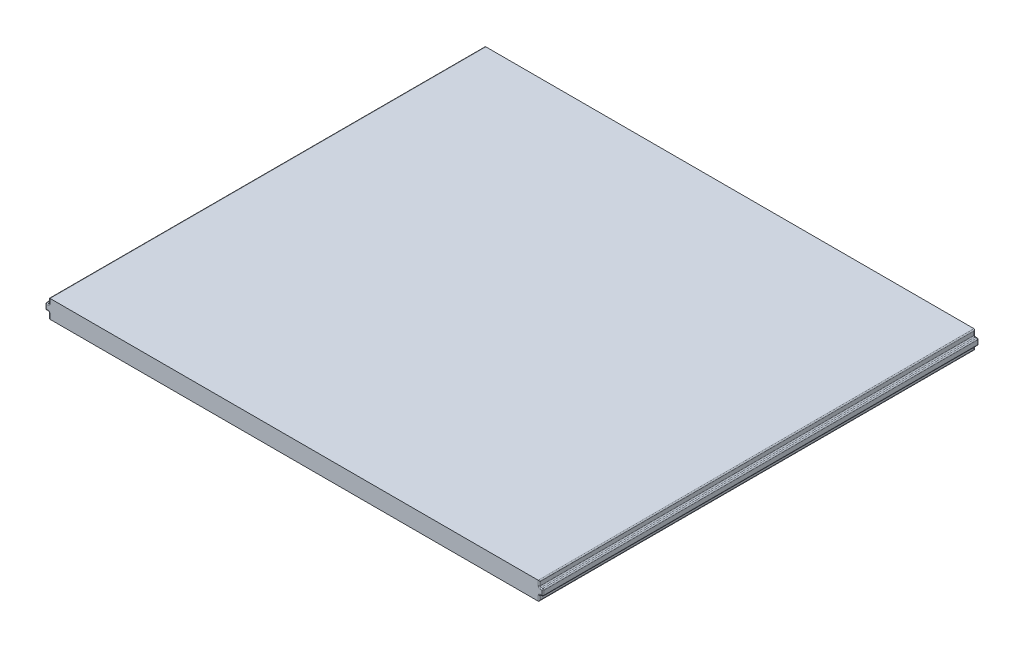
from build123d import *

# Parameters (mm, degrees)
SKETCH1_W           = 135
SKETCH1_H           = 120
BOSS_EXTRUDE1_DEPTH = 5
SKETCH2_W           = 120
SKETCH2_H           = 1.75
BOSS_EXTRUDE2_DEPTH = 1
FILLET1_R           = 0.3


with BuildPart() as part:
    # Sketch1 → Boss-Extrude1 (new body)
    with BuildSketch(Plane(origin=(0, 0, 0), x_dir=(1, 0, 0), z_dir=(0, 1, 0))):
        with Locations((1501.472148541, 1006.446286472)):
            Rectangle(SKETCH1_W, SKETCH1_H)
    extrude(amount=BOSS_EXTRUDE1_DEPTH)

    # Sketch2 → Boss-Extrude2 (add)
    with BuildSketch(Plane(origin=(1568.972148541, 0, 0), x_dir=(0, 0, -1), z_dir=(1, 0, 0))):
        with Locations((1006.446286472, 2.525)):
            Rectangle(SKETCH2_W, SKETCH2_H)
    boss_extrude2 = extrude(amount=BOSS_EXTRUDE2_DEPTH)

    # Mirror1: Boss-Extrude2 across plane
    add(boss_extrude2.mirror(Plane.ZY.offset(-1501.472148541)))

    # Fillet1
    fillet1_edges = [part.edges().sort_by_distance(p)[0] for p in [
        (1569.472148541, 1.65, -1066.446286472),
        (1569.472148541, 1.65, -946.446286472),
        (1569.472148541, 3.4, -946.446286472),
        (1569.472148541, 3.4, -1066.446286472),
        (1568.972148541, 0.825, -1066.446286472),
        (1568.972148541, 0, -1006.446286472),
        (1568.972148541, 0.825, -946.446286472),
        (1568.972148541, 1.65, -1006.446286472),
        (1569.972148541, 3.4, -1006.446286472),
        (1569.972148541, 2.525, -1066.446286472),
        (1569.972148541, 1.65, -1006.446286472),
        (1569.972148541, 2.525, -946.446286472),
        (1568.972148541, 4.2, -946.446286472),
        (1568.972148541, 5, -1006.446286472),
        (1568.972148541, 4.2, -1066.446286472),
        (1568.972148541, 3.4, -1006.446286472),
        (1433.472148541, 1.65, -1066.446286472),
        (1433.472148541, 1.65, -946.446286472),
        (1433.472148541, 3.4, -946.446286472),
        (1433.472148541, 3.4, -1066.446286472),
        (1433.972148541, 0, -1006.446286472),
        (1433.972148541, 0.825, -1066.446286472),
        (1433.972148541, 1.65, -1006.446286472),
        (1433.972148541, 0.825, -946.446286472),
        (1433.972148541, 5, -1006.446286472),
        (1433.972148541, 4.2, -946.446286472),
        (1433.972148541, 3.4, -1006.446286472),
        (1433.972148541, 4.2, -1066.446286472),
        (1432.972148541, 1.65, -1006.446286472),
        (1432.972148541, 2.525, -1066.446286472),
        (1432.972148541, 3.4, -1006.446286472),
        (1432.972148541, 2.525, -946.446286472),
    ]]
    fillet(fillet1_edges, radius=FILLET1_R)


solid = part.part
